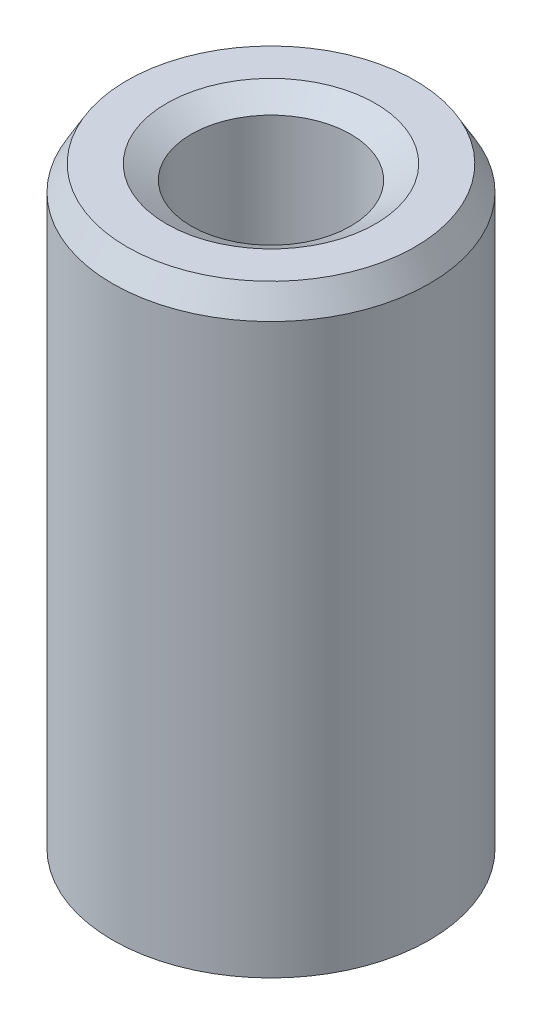
from build123d import *
from OCP.BRepFilletAPI import BRepFilletAPI_MakeChamfer

# Parameters (mm, degrees)
SKETCH1_R           = 25
BOSS_EXTRUDE1_DEPTH = 95.87572587
SKETCH2_R           = 12.578223989
CUT_EXTRUDE1_DEPTH  = 103.186862224
CHAMFER1_SIZE       = 3.908410965
CHAMFER1_SIZE2      = 2.256522123


with BuildPart() as part:
    # Sketch1 → Boss-Extrude1 (new body)
    with BuildSketch(Plane(origin=(0, 0, 0), x_dir=(1, 0, 0), z_dir=(0, 1, 0))):
        Circle(SKETCH1_R)
    extrude(amount=BOSS_EXTRUDE1_DEPTH)

    # Sketch2 → Cut-Extrude1 (cut, through all)
    with BuildSketch(Plane(origin=(0, 0, 0), x_dir=(1, 0, 0), z_dir=(0, 1, 0))):
        Circle(SKETCH2_R)
    extrude(amount=CUT_EXTRUDE1_DEPTH, mode=Mode.SUBTRACT)

    # Chamfer1: one chamfer whose edges measure the first distance from different faces: ONE call of the kernel's chamfer builder (chamfer() names one face for all edges)
    chamfer1_edges_1 = [part.edges().sort_by_distance(p)[0] for p in [
        (-12.578223989, 95.87572587, 0),
    ]]
    chamfer1_side_1 = [part.faces().sort_by_distance(p)[0] for p in [
        (-24.292893219, 95.87572587, 0),
    ]]
    chamfer1_edges_2 = [part.edges().sort_by_distance(p)[0] for p in [
        (-12.578223989, 0, 0),
    ]]
    chamfer1_side_2 = [part.faces().sort_by_distance(p)[0] for p in [
        (-12.578223989, 47.937862935, 0),
    ]]
    chamfer1_edges_3 = [part.edges().sort_by_distance(p)[0] for p in [
        (-25, 0, 0),
    ]]
    chamfer1_side_3 = [part.faces().sort_by_distance(p)[0] for p in [
        (-24.292893219, 0, 0),
    ]]
    chamfer1_edges_4 = [part.edges().sort_by_distance(p)[0] for p in [
        (-25, 95.87572587, 0),
    ]]
    chamfer1_side_4 = [part.faces().sort_by_distance(p)[0] for p in [
        (-25, 47.937862935, 0),
    ]]
    chamfer1 = BRepFilletAPI_MakeChamfer(part.part.solid().wrapped)
    for e in chamfer1_edges_1:
        chamfer1.Add(CHAMFER1_SIZE, CHAMFER1_SIZE2, e.wrapped, chamfer1_side_1[0].wrapped)  # the first distance lies on this face
    for e in chamfer1_edges_2:
        chamfer1.Add(CHAMFER1_SIZE, CHAMFER1_SIZE2, e.wrapped, chamfer1_side_2[0].wrapped)  # the first distance lies on this face
    for e in chamfer1_edges_3:
        chamfer1.Add(CHAMFER1_SIZE, CHAMFER1_SIZE2, e.wrapped, chamfer1_side_3[0].wrapped)  # the first distance lies on this face
    for e in chamfer1_edges_4:
        chamfer1.Add(CHAMFER1_SIZE, CHAMFER1_SIZE2, e.wrapped, chamfer1_side_4[0].wrapped)  # the first distance lies on this face
    add(Compound.cast(chamfer1.Shape()), mode=Mode.REPLACE)


solid = part.part
